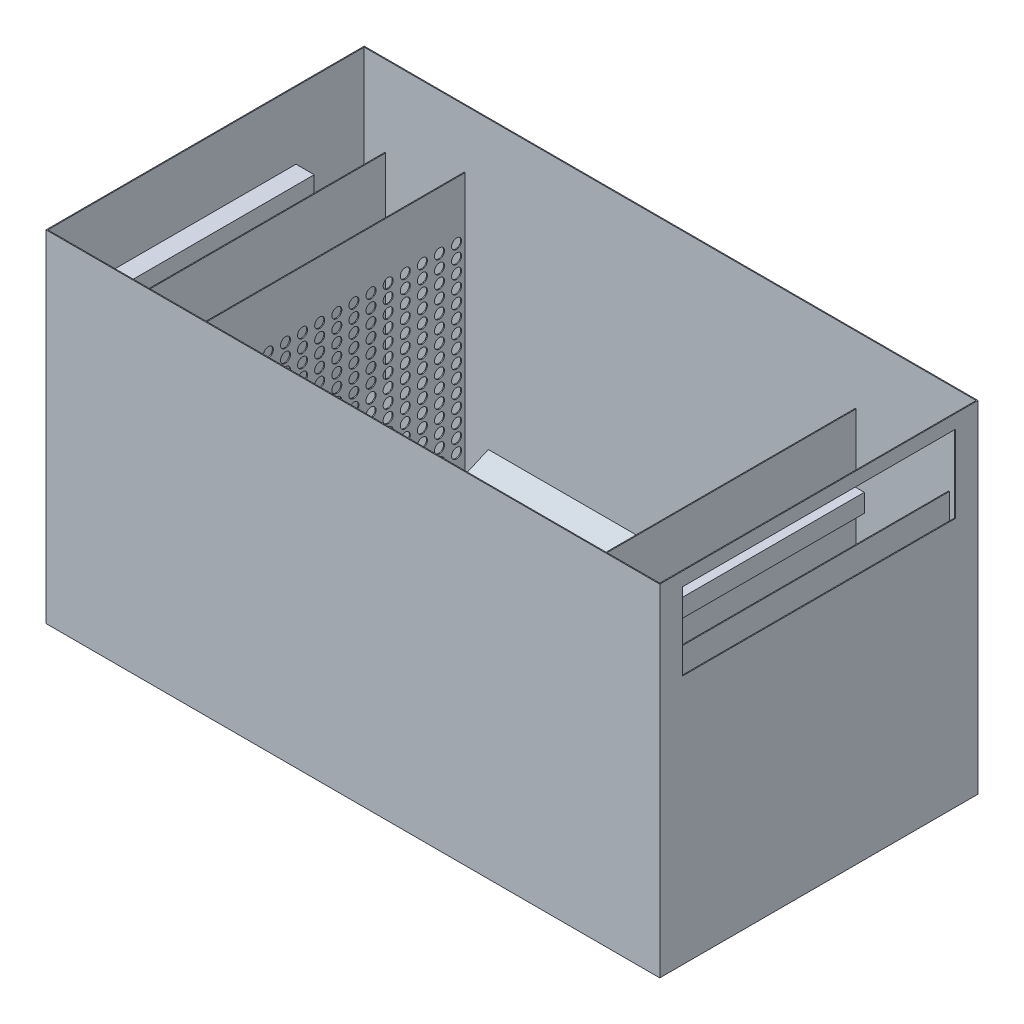
from build123d import *

# Parameters (mm, degrees)
MASTER_FOOTPRINT_W            = 1350
MASTER_FOOTPRINT_H            = 700
BATH_BASE_PLATE_DEPTH         = 750
BATH_SHELL_2MM_T              = -2
SKETCH_1_R                    = 50
INLET_D100_OPENING_DEPTH      = 10
INLET_IMPACT_BAFFLE_START     = 125
SKETCH_2_W                    = 540
SKETCH_2_H                    = 430
INLET_IMPACT_BAFFLE_DEPTH     = 2
DISTRIBUTOR_D22_START         = 250
SKETCH_3_W                    = 640
SKETCH_3_H                    = 648
SKETCH_3_R                    = 11
DISTRIBUTOR_D22_DEPTH         = 2
OUTLET_SUBMERGED_BAFFLE_START = 1130
SKETCH_4_W                    = 600
SKETCH_4_H                    = 330
OUTLET_SUBMERGED_BAFFLE_DEPTH = 2
OVERFLOW_WEIR_Z550_START      = 1290
SKETCH_5_W                    = 690
SKETCH_5_H                    = 548
OVERFLOW_WEIR_Z550_DEPTH      = 2
OUTLET_WEIR_SLOT_W600_START   = 1345
SKETCH_6_W                    = 600
SKETCH_6_H                    = 170
OUTLET_WEIR_SLOT_W600_DEPTH   = 10
SLOPED_SEDIMENT_FLOOR_START   = 275
SLOPED_SEDIMENT_FLOOR_DEPTH   = 825
SKETCH_8_W                    = 40
SKETCH_8_H                    = 40
FRAME_FOUR_LEGS_40X40_DEPTH   = 500
FRAME_FOUR_LEGS_40X40_2_DEPTH = 500
FRAME_FOUR_LEGS_40X40_3_DEPTH = 500
FRAME_FOUR_LEGS_40X40_4_DEPTH = 500


with BuildPart() as part:
    # MASTER_FOOTPRINT → BATH_BASE_PLATE (new body)
    with BuildSketch(Plane(origin=(0, 0, 0), x_dir=(1, 0, 0), z_dir=(0, 1, 0))):
        with Locations((675, 350)):
            Rectangle(MASTER_FOOTPRINT_W, MASTER_FOOTPRINT_H)
    extrude(amount=BATH_BASE_PLATE_DEPTH)

    # BATH_SHELL_2MM
    bath_shell_2mm_openings = [part.faces().sort_by_distance(p)[0] for p in [
        (675, 750, -350),
    ]]
    offset(amount=BATH_SHELL_2MM_T, openings=bath_shell_2mm_openings, kind=Kind.INTERSECTION)

    # Эскиз1 → INLET_D100_OPENING (cut)
    with BuildSketch(Plane(origin=(0, 0, 0), x_dir=(0, 0, -1), z_dir=(1, 0, 0))):
        with Locations((350, 420)):
            Circle(SKETCH_1_R)
    extrude(amount=INLET_D100_OPENING_DEPTH, mode=Mode.SUBTRACT)

    # Эскиз6 → OUTLET_WEIR_SLOT_W600 (cut)
    with BuildSketch(Plane(origin=(0, 0, 0), x_dir=(0, 0, -1), z_dir=(1, 0, 0)).offset(OUTLET_WEIR_SLOT_W600_START)):
        with Locations((350, 635)):
            Rectangle(SKETCH_6_W, SKETCH_6_H)
    extrude(amount=OUTLET_WEIR_SLOT_W600_DEPTH, mode=Mode.SUBTRACT)

    # Эскиз7 → SLOPED_SEDIMENT_FLOOR (add)
    with BuildSketch(Plane(origin=(0, 0, 0), x_dir=(0, 0, -1), z_dir=(1, 0, 0)).offset(SLOPED_SEDIMENT_FLOOR_START)):
        Polygon((2, -1), (2, 120), (280, -1), align=None)
        Polygon((698, -1), (698, 120), (420, -1), align=None)
    extrude(amount=SLOPED_SEDIMENT_FLOOR_DEPTH)


with BuildPart() as body_2:
    # Эскиз2 → INLET_IMPACT_BAFFLE (new body)
    with BuildSketch(Plane(origin=(0, 0, 0), x_dir=(0, 0, -1), z_dir=(1, 0, 0)).offset(INLET_IMPACT_BAFFLE_START)):
        with Locations((350, 435)):
            Rectangle(SKETCH_2_W, SKETCH_2_H)
    extrude(amount=INLET_IMPACT_BAFFLE_DEPTH)


with BuildPart() as body_3:
    # Эскиз3 → DISTRIBUTOR_D22 (new body)
    with BuildSketch(Plane(origin=(0, 0, 0), x_dir=(0, 0, -1), z_dir=(1, 0, 0)).offset(DISTRIBUTOR_D22_START)):
        with Locations((350, 326)):
            Rectangle(SKETCH_3_W, SKETCH_3_H)
        with Locations((48.823529412, 125)):
            Circle(SKETCH_3_R, mode=Mode.SUBTRACT)
        with Locations((48.823529412, 153.5)):
            Circle(SKETCH_3_R, mode=Mode.SUBTRACT)
        with Locations((48.823529412, 182)):
            Circle(SKETCH_3_R, mode=Mode.SUBTRACT)
        with Locations((48.823529412, 210.5)):
            Circle(SKETCH_3_R, mode=Mode.SUBTRACT)
        with Locations((48.823529412, 239)):
            Circle(SKETCH_3_R, mode=Mode.SUBTRACT)
        with Locations((48.823529412, 267.5)):
            Circle(SKETCH_3_R, mode=Mode.SUBTRACT)
        with Locations((48.823529412, 296)):
            Circle(SKETCH_3_R, mode=Mode.SUBTRACT)
        with Locations((48.823529412, 324.5)):
            Circle(SKETCH_3_R, mode=Mode.SUBTRACT)
        with Locations((48.823529412, 353)):
            Circle(SKETCH_3_R, mode=Mode.SUBTRACT)
        with Locations((48.823529412, 381.5)):
            Circle(SKETCH_3_R, mode=Mode.SUBTRACT)
        with Locations((48.823529412, 410)):
            Circle(SKETCH_3_R, mode=Mode.SUBTRACT)
        with Locations((48.823529412, 438.5)):
            Circle(SKETCH_3_R, mode=Mode.SUBTRACT)
        with Locations((48.823529412, 467)):
            Circle(SKETCH_3_R, mode=Mode.SUBTRACT)
        with Locations((48.823529412, 495.5)):
            Circle(SKETCH_3_R, mode=Mode.SUBTRACT)
        with Locations((48.823529412, 524)):
            Circle(SKETCH_3_R, mode=Mode.SUBTRACT)
        with Locations((86.470588235, 125)):
            Circle(SKETCH_3_R, mode=Mode.SUBTRACT)
        with Locations((86.470588235, 153.5)):
            Circle(SKETCH_3_R, mode=Mode.SUBTRACT)
        with Locations((86.470588235, 182)):
            Circle(SKETCH_3_R, mode=Mode.SUBTRACT)
        with Locations((86.470588235, 210.5)):
            Circle(SKETCH_3_R, mode=Mode.SUBTRACT)
        with Locations((86.470588235, 239)):
            Circle(SKETCH_3_R, mode=Mode.SUBTRACT)
        with Locations((86.470588235, 267.5)):
            Circle(SKETCH_3_R, mode=Mode.SUBTRACT)
        with Locations((86.470588235, 296)):
            Circle(SKETCH_3_R, mode=Mode.SUBTRACT)
        with Locations((86.470588235, 324.5)):
            Circle(SKETCH_3_R, mode=Mode.SUBTRACT)
        with Locations((86.470588235, 353)):
            Circle(SKETCH_3_R, mode=Mode.SUBTRACT)
        with Locations((86.470588235, 381.5)):
            Circle(SKETCH_3_R, mode=Mode.SUBTRACT)
        with Locations((86.470588235, 410)):
            Circle(SKETCH_3_R, mode=Mode.SUBTRACT)
        with Locations((86.470588235, 438.5)):
            Circle(SKETCH_3_R, mode=Mode.SUBTRACT)
        with Locations((86.470588235, 467)):
            Circle(SKETCH_3_R, mode=Mode.SUBTRACT)
        with Locations((86.470588235, 495.5)):
            Circle(SKETCH_3_R, mode=Mode.SUBTRACT)
        with Locations((86.470588235, 524)):
            Circle(SKETCH_3_R, mode=Mode.SUBTRACT)
        with Locations((124.117647059, 125)):
            Circle(SKETCH_3_R, mode=Mode.SUBTRACT)
        with Locations((124.117647059, 153.5)):
            Circle(SKETCH_3_R, mode=Mode.SUBTRACT)
        with Locations((124.117647059, 182)):
            Circle(SKETCH_3_R, mode=Mode.SUBTRACT)
        with Locations((124.117647059, 210.5)):
            Circle(SKETCH_3_R, mode=Mode.SUBTRACT)
        with Locations((124.117647059, 239)):
            Circle(SKETCH_3_R, mode=Mode.SUBTRACT)
        with Locations((124.117647059, 267.5)):
            Circle(SKETCH_3_R, mode=Mode.SUBTRACT)
        with Locations((124.117647059, 296)):
            Circle(SKETCH_3_R, mode=Mode.SUBTRACT)
        with Locations((124.117647059, 324.5)):
            Circle(SKETCH_3_R, mode=Mode.SUBTRACT)
        with Locations((124.117647059, 353)):
            Circle(SKETCH_3_R, mode=Mode.SUBTRACT)
        with Locations((124.117647059, 381.5)):
            Circle(SKETCH_3_R, mode=Mode.SUBTRACT)
        with Locations((124.117647059, 410)):
            Circle(SKETCH_3_R, mode=Mode.SUBTRACT)
        with Locations((124.117647059, 438.5)):
            Circle(SKETCH_3_R, mode=Mode.SUBTRACT)
        with Locations((124.117647059, 467)):
            Circle(SKETCH_3_R, mode=Mode.SUBTRACT)
        with Locations((124.117647059, 495.5)):
            Circle(SKETCH_3_R, mode=Mode.SUBTRACT)
        with Locations((124.117647059, 524)):
            Circle(SKETCH_3_R, mode=Mode.SUBTRACT)
        with Locations((161.764705882, 125)):
            Circle(SKETCH_3_R, mode=Mode.SUBTRACT)
        with Locations((161.764705882, 153.5)):
            Circle(SKETCH_3_R, mode=Mode.SUBTRACT)
        with Locations((161.764705882, 182)):
            Circle(SKETCH_3_R, mode=Mode.SUBTRACT)
        with Locations((161.764705882, 210.5)):
            Circle(SKETCH_3_R, mode=Mode.SUBTRACT)
        with Locations((161.764705882, 239)):
            Circle(SKETCH_3_R, mode=Mode.SUBTRACT)
        with Locations((161.764705882, 267.5)):
            Circle(SKETCH_3_R, mode=Mode.SUBTRACT)
        with Locations((161.764705882, 296)):
            Circle(SKETCH_3_R, mode=Mode.SUBTRACT)
        with Locations((161.764705882, 324.5)):
            Circle(SKETCH_3_R, mode=Mode.SUBTRACT)
        with Locations((161.764705882, 353)):
            Circle(SKETCH_3_R, mode=Mode.SUBTRACT)
        with Locations((161.764705882, 381.5)):
            Circle(SKETCH_3_R, mode=Mode.SUBTRACT)
        with Locations((161.764705882, 410)):
            Circle(SKETCH_3_R, mode=Mode.SUBTRACT)
        with Locations((161.764705882, 438.5)):
            Circle(SKETCH_3_R, mode=Mode.SUBTRACT)
        with Locations((161.764705882, 467)):
            Circle(SKETCH_3_R, mode=Mode.SUBTRACT)
        with Locations((161.764705882, 495.5)):
            Circle(SKETCH_3_R, mode=Mode.SUBTRACT)
        with Locations((161.764705882, 524)):
            Circle(SKETCH_3_R, mode=Mode.SUBTRACT)
        with Locations((199.411764706, 125)):
            Circle(SKETCH_3_R, mode=Mode.SUBTRACT)
        with Locations((199.411764706, 153.5)):
            Circle(SKETCH_3_R, mode=Mode.SUBTRACT)
        with Locations((199.411764706, 182)):
            Circle(SKETCH_3_R, mode=Mode.SUBTRACT)
        with Locations((199.411764706, 210.5)):
            Circle(SKETCH_3_R, mode=Mode.SUBTRACT)
        with Locations((199.411764706, 239)):
            Circle(SKETCH_3_R, mode=Mode.SUBTRACT)
        with Locations((199.411764706, 267.5)):
            Circle(SKETCH_3_R, mode=Mode.SUBTRACT)
        with Locations((199.411764706, 296)):
            Circle(SKETCH_3_R, mode=Mode.SUBTRACT)
        with Locations((199.411764706, 324.5)):
            Circle(SKETCH_3_R, mode=Mode.SUBTRACT)
        with Locations((199.411764706, 353)):
            Circle(SKETCH_3_R, mode=Mode.SUBTRACT)
        with Locations((199.411764706, 381.5)):
            Circle(SKETCH_3_R, mode=Mode.SUBTRACT)
        with Locations((199.411764706, 410)):
            Circle(SKETCH_3_R, mode=Mode.SUBTRACT)
        with Locations((199.411764706, 438.5)):
            Circle(SKETCH_3_R, mode=Mode.SUBTRACT)
        with Locations((199.411764706, 467)):
            Circle(SKETCH_3_R, mode=Mode.SUBTRACT)
        with Locations((199.411764706, 495.5)):
            Circle(SKETCH_3_R, mode=Mode.SUBTRACT)
        with Locations((199.411764706, 524)):
            Circle(SKETCH_3_R, mode=Mode.SUBTRACT)
        with Locations((237.058823529, 125)):
            Circle(SKETCH_3_R, mode=Mode.SUBTRACT)
        with Locations((237.058823529, 153.5)):
            Circle(SKETCH_3_R, mode=Mode.SUBTRACT)
        with Locations((237.058823529, 182)):
            Circle(SKETCH_3_R, mode=Mode.SUBTRACT)
        with Locations((237.058823529, 210.5)):
            Circle(SKETCH_3_R, mode=Mode.SUBTRACT)
        with Locations((237.058823529, 239)):
            Circle(SKETCH_3_R, mode=Mode.SUBTRACT)
        with Locations((237.058823529, 267.5)):
            Circle(SKETCH_3_R, mode=Mode.SUBTRACT)
        with Locations((237.058823529, 296)):
            Circle(SKETCH_3_R, mode=Mode.SUBTRACT)
        with Locations((237.058823529, 324.5)):
            Circle(SKETCH_3_R, mode=Mode.SUBTRACT)
        with Locations((237.058823529, 353)):
            Circle(SKETCH_3_R, mode=Mode.SUBTRACT)
        with Locations((237.058823529, 381.5)):
            Circle(SKETCH_3_R, mode=Mode.SUBTRACT)
        with Locations((237.058823529, 410)):
            Circle(SKETCH_3_R, mode=Mode.SUBTRACT)
        with Locations((237.058823529, 438.5)):
            Circle(SKETCH_3_R, mode=Mode.SUBTRACT)
        with Locations((237.058823529, 467)):
            Circle(SKETCH_3_R, mode=Mode.SUBTRACT)
        with Locations((237.058823529, 495.5)):
            Circle(SKETCH_3_R, mode=Mode.SUBTRACT)
        with Locations((237.058823529, 524)):
            Circle(SKETCH_3_R, mode=Mode.SUBTRACT)
        with Locations((274.705882353, 125)):
            Circle(SKETCH_3_R, mode=Mode.SUBTRACT)
        with Locations((274.705882353, 153.5)):
            Circle(SKETCH_3_R, mode=Mode.SUBTRACT)
        with Locations((274.705882353, 182)):
            Circle(SKETCH_3_R, mode=Mode.SUBTRACT)
        with Locations((274.705882353, 210.5)):
            Circle(SKETCH_3_R, mode=Mode.SUBTRACT)
        with Locations((274.705882353, 239)):
            Circle(SKETCH_3_R, mode=Mode.SUBTRACT)
        with Locations((274.705882353, 267.5)):
            Circle(SKETCH_3_R, mode=Mode.SUBTRACT)
        with Locations((274.705882353, 296)):
            Circle(SKETCH_3_R, mode=Mode.SUBTRACT)
        with Locations((274.705882353, 324.5)):
            Circle(SKETCH_3_R, mode=Mode.SUBTRACT)
        with Locations((274.705882353, 353)):
            Circle(SKETCH_3_R, mode=Mode.SUBTRACT)
        with Locations((274.705882353, 381.5)):
            Circle(SKETCH_3_R, mode=Mode.SUBTRACT)
        with Locations((274.705882353, 410)):
            Circle(SKETCH_3_R, mode=Mode.SUBTRACT)
        with Locations((274.705882353, 438.5)):
            Circle(SKETCH_3_R, mode=Mode.SUBTRACT)
        with Locations((274.705882353, 467)):
            Circle(SKETCH_3_R, mode=Mode.SUBTRACT)
        with Locations((274.705882353, 495.5)):
            Circle(SKETCH_3_R, mode=Mode.SUBTRACT)
        with Locations((274.705882353, 524)):
            Circle(SKETCH_3_R, mode=Mode.SUBTRACT)
        with Locations((312.352941176, 125)):
            Circle(SKETCH_3_R, mode=Mode.SUBTRACT)
        with Locations((312.352941176, 153.5)):
            Circle(SKETCH_3_R, mode=Mode.SUBTRACT)
        with Locations((312.352941176, 182)):
            Circle(SKETCH_3_R, mode=Mode.SUBTRACT)
        with Locations((312.352941176, 210.5)):
            Circle(SKETCH_3_R, mode=Mode.SUBTRACT)
        with Locations((312.352941176, 239)):
            Circle(SKETCH_3_R, mode=Mode.SUBTRACT)
        with Locations((312.352941176, 267.5)):
            Circle(SKETCH_3_R, mode=Mode.SUBTRACT)
        with Locations((312.352941176, 296)):
            Circle(SKETCH_3_R, mode=Mode.SUBTRACT)
        with Locations((312.352941176, 324.5)):
            Circle(SKETCH_3_R, mode=Mode.SUBTRACT)
        with Locations((312.352941176, 353)):
            Circle(SKETCH_3_R, mode=Mode.SUBTRACT)
        with Locations((312.352941176, 381.5)):
            Circle(SKETCH_3_R, mode=Mode.SUBTRACT)
        with Locations((312.352941176, 410)):
            Circle(SKETCH_3_R, mode=Mode.SUBTRACT)
        with Locations((312.352941176, 438.5)):
            Circle(SKETCH_3_R, mode=Mode.SUBTRACT)
        with Locations((312.352941176, 467)):
            Circle(SKETCH_3_R, mode=Mode.SUBTRACT)
        with Locations((312.352941176, 495.5)):
            Circle(SKETCH_3_R, mode=Mode.SUBTRACT)
        with Locations((312.352941176, 524)):
            Circle(SKETCH_3_R, mode=Mode.SUBTRACT)
        with Locations((350, 125)):
            Circle(SKETCH_3_R, mode=Mode.SUBTRACT)
        with Locations((350, 153.5)):
            Circle(SKETCH_3_R, mode=Mode.SUBTRACT)
        with Locations((350, 182)):
            Circle(SKETCH_3_R, mode=Mode.SUBTRACT)
        with Locations((350, 210.5)):
            Circle(SKETCH_3_R, mode=Mode.SUBTRACT)
        with Locations((350, 239)):
            Circle(SKETCH_3_R, mode=Mode.SUBTRACT)
        with Locations((350, 267.5)):
            Circle(SKETCH_3_R, mode=Mode.SUBTRACT)
        with Locations((350, 296)):
            Circle(SKETCH_3_R, mode=Mode.SUBTRACT)
        with Locations((350, 324.5)):
            Circle(SKETCH_3_R, mode=Mode.SUBTRACT)
        with Locations((350, 353)):
            Circle(SKETCH_3_R, mode=Mode.SUBTRACT)
        with Locations((350, 381.5)):
            Circle(SKETCH_3_R, mode=Mode.SUBTRACT)
        with Locations((350, 410)):
            Circle(SKETCH_3_R, mode=Mode.SUBTRACT)
        with Locations((350, 438.5)):
            Circle(SKETCH_3_R, mode=Mode.SUBTRACT)
        with Locations((350, 467)):
            Circle(SKETCH_3_R, mode=Mode.SUBTRACT)
        with Locations((350, 495.5)):
            Circle(SKETCH_3_R, mode=Mode.SUBTRACT)
        with Locations((350, 524)):
            Circle(SKETCH_3_R, mode=Mode.SUBTRACT)
        with Locations((387.647058824, 125)):
            Circle(SKETCH_3_R, mode=Mode.SUBTRACT)
        with Locations((387.647058824, 153.5)):
            Circle(SKETCH_3_R, mode=Mode.SUBTRACT)
        with Locations((387.647058824, 182)):
            Circle(SKETCH_3_R, mode=Mode.SUBTRACT)
        with Locations((387.647058824, 210.5)):
            Circle(SKETCH_3_R, mode=Mode.SUBTRACT)
        with Locations((387.647058824, 239)):
            Circle(SKETCH_3_R, mode=Mode.SUBTRACT)
        with Locations((387.647058824, 267.5)):
            Circle(SKETCH_3_R, mode=Mode.SUBTRACT)
        with Locations((387.647058824, 296)):
            Circle(SKETCH_3_R, mode=Mode.SUBTRACT)
        with Locations((387.647058824, 324.5)):
            Circle(SKETCH_3_R, mode=Mode.SUBTRACT)
        with Locations((387.647058824, 353)):
            Circle(SKETCH_3_R, mode=Mode.SUBTRACT)
        with Locations((387.647058824, 381.5)):
            Circle(SKETCH_3_R, mode=Mode.SUBTRACT)
        with Locations((387.647058824, 410)):
            Circle(SKETCH_3_R, mode=Mode.SUBTRACT)
        with Locations((387.647058824, 438.5)):
            Circle(SKETCH_3_R, mode=Mode.SUBTRACT)
        with Locations((387.647058824, 467)):
            Circle(SKETCH_3_R, mode=Mode.SUBTRACT)
        with Locations((387.647058824, 495.5)):
            Circle(SKETCH_3_R, mode=Mode.SUBTRACT)
        with Locations((387.647058824, 524)):
            Circle(SKETCH_3_R, mode=Mode.SUBTRACT)
        with Locations((425.294117647, 125)):
            Circle(SKETCH_3_R, mode=Mode.SUBTRACT)
        with Locations((425.294117647, 153.5)):
            Circle(SKETCH_3_R, mode=Mode.SUBTRACT)
        with Locations((425.294117647, 182)):
            Circle(SKETCH_3_R, mode=Mode.SUBTRACT)
        with Locations((425.294117647, 210.5)):
            Circle(SKETCH_3_R, mode=Mode.SUBTRACT)
        with Locations((425.294117647, 239)):
            Circle(SKETCH_3_R, mode=Mode.SUBTRACT)
        with Locations((425.294117647, 267.5)):
            Circle(SKETCH_3_R, mode=Mode.SUBTRACT)
        with Locations((425.294117647, 296)):
            Circle(SKETCH_3_R, mode=Mode.SUBTRACT)
        with Locations((425.294117647, 324.5)):
            Circle(SKETCH_3_R, mode=Mode.SUBTRACT)
        with Locations((425.294117647, 353)):
            Circle(SKETCH_3_R, mode=Mode.SUBTRACT)
        with Locations((425.294117647, 381.5)):
            Circle(SKETCH_3_R, mode=Mode.SUBTRACT)
        with Locations((425.294117647, 410)):
            Circle(SKETCH_3_R, mode=Mode.SUBTRACT)
        with Locations((425.294117647, 438.5)):
            Circle(SKETCH_3_R, mode=Mode.SUBTRACT)
        with Locations((425.294117647, 467)):
            Circle(SKETCH_3_R, mode=Mode.SUBTRACT)
        with Locations((425.294117647, 495.5)):
            Circle(SKETCH_3_R, mode=Mode.SUBTRACT)
        with Locations((425.294117647, 524)):
            Circle(SKETCH_3_R, mode=Mode.SUBTRACT)
        with Locations((462.941176471, 125)):
            Circle(SKETCH_3_R, mode=Mode.SUBTRACT)
        with Locations((462.941176471, 153.5)):
            Circle(SKETCH_3_R, mode=Mode.SUBTRACT)
        with Locations((462.941176471, 182)):
            Circle(SKETCH_3_R, mode=Mode.SUBTRACT)
        with Locations((462.941176471, 210.5)):
            Circle(SKETCH_3_R, mode=Mode.SUBTRACT)
        with Locations((462.941176471, 239)):
            Circle(SKETCH_3_R, mode=Mode.SUBTRACT)
        with Locations((462.941176471, 267.5)):
            Circle(SKETCH_3_R, mode=Mode.SUBTRACT)
        with Locations((462.941176471, 296)):
            Circle(SKETCH_3_R, mode=Mode.SUBTRACT)
        with Locations((462.941176471, 324.5)):
            Circle(SKETCH_3_R, mode=Mode.SUBTRACT)
        with Locations((462.941176471, 353)):
            Circle(SKETCH_3_R, mode=Mode.SUBTRACT)
        with Locations((462.941176471, 381.5)):
            Circle(SKETCH_3_R, mode=Mode.SUBTRACT)
        with Locations((462.941176471, 410)):
            Circle(SKETCH_3_R, mode=Mode.SUBTRACT)
        with Locations((462.941176471, 438.5)):
            Circle(SKETCH_3_R, mode=Mode.SUBTRACT)
        with Locations((462.941176471, 467)):
            Circle(SKETCH_3_R, mode=Mode.SUBTRACT)
        with Locations((462.941176471, 495.5)):
            Circle(SKETCH_3_R, mode=Mode.SUBTRACT)
        with Locations((462.941176471, 524)):
            Circle(SKETCH_3_R, mode=Mode.SUBTRACT)
        with Locations((500.588235294, 125)):
            Circle(SKETCH_3_R, mode=Mode.SUBTRACT)
        with Locations((500.588235294, 153.5)):
            Circle(SKETCH_3_R, mode=Mode.SUBTRACT)
        with Locations((500.588235294, 182)):
            Circle(SKETCH_3_R, mode=Mode.SUBTRACT)
        with Locations((500.588235294, 210.5)):
            Circle(SKETCH_3_R, mode=Mode.SUBTRACT)
        with Locations((500.588235294, 239)):
            Circle(SKETCH_3_R, mode=Mode.SUBTRACT)
        with Locations((500.588235294, 267.5)):
            Circle(SKETCH_3_R, mode=Mode.SUBTRACT)
        with Locations((500.588235294, 296)):
            Circle(SKETCH_3_R, mode=Mode.SUBTRACT)
        with Locations((500.588235294, 324.5)):
            Circle(SKETCH_3_R, mode=Mode.SUBTRACT)
        with Locations((500.588235294, 353)):
            Circle(SKETCH_3_R, mode=Mode.SUBTRACT)
        with Locations((500.588235294, 381.5)):
            Circle(SKETCH_3_R, mode=Mode.SUBTRACT)
        with Locations((500.588235294, 410)):
            Circle(SKETCH_3_R, mode=Mode.SUBTRACT)
        with Locations((500.588235294, 438.5)):
            Circle(SKETCH_3_R, mode=Mode.SUBTRACT)
        with Locations((500.588235294, 467)):
            Circle(SKETCH_3_R, mode=Mode.SUBTRACT)
        with Locations((500.588235294, 495.5)):
            Circle(SKETCH_3_R, mode=Mode.SUBTRACT)
        with Locations((500.588235294, 524)):
            Circle(SKETCH_3_R, mode=Mode.SUBTRACT)
        with Locations((538.235294118, 125)):
            Circle(SKETCH_3_R, mode=Mode.SUBTRACT)
        with Locations((538.235294118, 153.5)):
            Circle(SKETCH_3_R, mode=Mode.SUBTRACT)
        with Locations((538.235294118, 182)):
            Circle(SKETCH_3_R, mode=Mode.SUBTRACT)
        with Locations((538.235294118, 210.5)):
            Circle(SKETCH_3_R, mode=Mode.SUBTRACT)
        with Locations((538.235294118, 239)):
            Circle(SKETCH_3_R, mode=Mode.SUBTRACT)
        with Locations((538.235294118, 267.5)):
            Circle(SKETCH_3_R, mode=Mode.SUBTRACT)
        with Locations((538.235294118, 296)):
            Circle(SKETCH_3_R, mode=Mode.SUBTRACT)
        with Locations((538.235294118, 324.5)):
            Circle(SKETCH_3_R, mode=Mode.SUBTRACT)
        with Locations((538.235294118, 353)):
            Circle(SKETCH_3_R, mode=Mode.SUBTRACT)
        with Locations((538.235294118, 381.5)):
            Circle(SKETCH_3_R, mode=Mode.SUBTRACT)
        with Locations((538.235294118, 410)):
            Circle(SKETCH_3_R, mode=Mode.SUBTRACT)
        with Locations((538.235294118, 438.5)):
            Circle(SKETCH_3_R, mode=Mode.SUBTRACT)
        with Locations((538.235294118, 467)):
            Circle(SKETCH_3_R, mode=Mode.SUBTRACT)
        with Locations((538.235294118, 495.5)):
            Circle(SKETCH_3_R, mode=Mode.SUBTRACT)
        with Locations((538.235294118, 524)):
            Circle(SKETCH_3_R, mode=Mode.SUBTRACT)
        with Locations((575.882352941, 125)):
            Circle(SKETCH_3_R, mode=Mode.SUBTRACT)
        with Locations((575.882352941, 153.5)):
            Circle(SKETCH_3_R, mode=Mode.SUBTRACT)
        with Locations((575.882352941, 182)):
            Circle(SKETCH_3_R, mode=Mode.SUBTRACT)
        with Locations((575.882352941, 210.5)):
            Circle(SKETCH_3_R, mode=Mode.SUBTRACT)
        with Locations((575.882352941, 239)):
            Circle(SKETCH_3_R, mode=Mode.SUBTRACT)
        with Locations((575.882352941, 267.5)):
            Circle(SKETCH_3_R, mode=Mode.SUBTRACT)
        with Locations((575.882352941, 296)):
            Circle(SKETCH_3_R, mode=Mode.SUBTRACT)
        with Locations((575.882352941, 324.5)):
            Circle(SKETCH_3_R, mode=Mode.SUBTRACT)
        with Locations((575.882352941, 353)):
            Circle(SKETCH_3_R, mode=Mode.SUBTRACT)
        with Locations((575.882352941, 381.5)):
            Circle(SKETCH_3_R, mode=Mode.SUBTRACT)
        with Locations((575.882352941, 410)):
            Circle(SKETCH_3_R, mode=Mode.SUBTRACT)
        with Locations((575.882352941, 438.5)):
            Circle(SKETCH_3_R, mode=Mode.SUBTRACT)
        with Locations((575.882352941, 467)):
            Circle(SKETCH_3_R, mode=Mode.SUBTRACT)
        with Locations((575.882352941, 495.5)):
            Circle(SKETCH_3_R, mode=Mode.SUBTRACT)
        with Locations((575.882352941, 524)):
            Circle(SKETCH_3_R, mode=Mode.SUBTRACT)
        with Locations((613.529411765, 125)):
            Circle(SKETCH_3_R, mode=Mode.SUBTRACT)
        with Locations((613.529411765, 153.5)):
            Circle(SKETCH_3_R, mode=Mode.SUBTRACT)
        with Locations((613.529411765, 182)):
            Circle(SKETCH_3_R, mode=Mode.SUBTRACT)
        with Locations((613.529411765, 210.5)):
            Circle(SKETCH_3_R, mode=Mode.SUBTRACT)
        with Locations((613.529411765, 239)):
            Circle(SKETCH_3_R, mode=Mode.SUBTRACT)
        with Locations((613.529411765, 267.5)):
            Circle(SKETCH_3_R, mode=Mode.SUBTRACT)
        with Locations((613.529411765, 296)):
            Circle(SKETCH_3_R, mode=Mode.SUBTRACT)
        with Locations((613.529411765, 324.5)):
            Circle(SKETCH_3_R, mode=Mode.SUBTRACT)
        with Locations((613.529411765, 353)):
            Circle(SKETCH_3_R, mode=Mode.SUBTRACT)
        with Locations((613.529411765, 381.5)):
            Circle(SKETCH_3_R, mode=Mode.SUBTRACT)
        with Locations((613.529411765, 410)):
            Circle(SKETCH_3_R, mode=Mode.SUBTRACT)
        with Locations((613.529411765, 438.5)):
            Circle(SKETCH_3_R, mode=Mode.SUBTRACT)
        with Locations((613.529411765, 467)):
            Circle(SKETCH_3_R, mode=Mode.SUBTRACT)
        with Locations((613.529411765, 495.5)):
            Circle(SKETCH_3_R, mode=Mode.SUBTRACT)
        with Locations((613.529411765, 524)):
            Circle(SKETCH_3_R, mode=Mode.SUBTRACT)
        with Locations((651.176470588, 125)):
            Circle(SKETCH_3_R, mode=Mode.SUBTRACT)
        with Locations((651.176470588, 153.5)):
            Circle(SKETCH_3_R, mode=Mode.SUBTRACT)
        with Locations((651.176470588, 182)):
            Circle(SKETCH_3_R, mode=Mode.SUBTRACT)
        with Locations((651.176470588, 210.5)):
            Circle(SKETCH_3_R, mode=Mode.SUBTRACT)
        with Locations((651.176470588, 239)):
            Circle(SKETCH_3_R, mode=Mode.SUBTRACT)
        with Locations((651.176470588, 267.5)):
            Circle(SKETCH_3_R, mode=Mode.SUBTRACT)
        with Locations((651.176470588, 296)):
            Circle(SKETCH_3_R, mode=Mode.SUBTRACT)
        with Locations((651.176470588, 324.5)):
            Circle(SKETCH_3_R, mode=Mode.SUBTRACT)
        with Locations((651.176470588, 353)):
            Circle(SKETCH_3_R, mode=Mode.SUBTRACT)
        with Locations((651.176470588, 381.5)):
            Circle(SKETCH_3_R, mode=Mode.SUBTRACT)
        with Locations((651.176470588, 410)):
            Circle(SKETCH_3_R, mode=Mode.SUBTRACT)
        with Locations((651.176470588, 438.5)):
            Circle(SKETCH_3_R, mode=Mode.SUBTRACT)
        with Locations((651.176470588, 467)):
            Circle(SKETCH_3_R, mode=Mode.SUBTRACT)
        with Locations((651.176470588, 495.5)):
            Circle(SKETCH_3_R, mode=Mode.SUBTRACT)
        with Locations((651.176470588, 524)):
            Circle(SKETCH_3_R, mode=Mode.SUBTRACT)
    extrude(amount=DISTRIBUTOR_D22_DEPTH)


with BuildPart() as body_4:
    # Эскиз4 → OUTLET_SUBMERGED_BAFFLE (new body)
    with BuildSketch(Plane(origin=(0, 0, 0), x_dir=(0, 0, -1), z_dir=(1, 0, 0)).offset(OUTLET_SUBMERGED_BAFFLE_START)):
        with Locations((350, 485)):
            Rectangle(SKETCH_4_W, SKETCH_4_H)
    extrude(amount=OUTLET_SUBMERGED_BAFFLE_DEPTH)


with BuildPart() as body_5:
    # Эскиз5 → OVERFLOW_WEIR_Z550 (new body)
    with BuildSketch(Plane(origin=(0, 0, 0), x_dir=(0, 0, -1), z_dir=(1, 0, 0)).offset(OVERFLOW_WEIR_Z550_START)):
        with Locations((350, 276)):
            Rectangle(SKETCH_5_W, SKETCH_5_H)
    extrude(amount=OVERFLOW_WEIR_Z550_DEPTH)


with BuildPart() as body_6:
    # Эскиз8 → FRAME_FOUR_LEGS_40X40 (new body)
    with BuildSketch(Plane.XY):
        with Locations((70, 70)):
            Rectangle(SKETCH_8_W, SKETCH_8_H)
    extrude(amount=-FRAME_FOUR_LEGS_40X40_DEPTH)


with BuildPart() as body_7:
    # Эскиз8 → FRAME_FOUR_LEGS_40X40 2 (new body)
    with BuildSketch(Plane.XY):
        with Locations((70, 630)):
            Rectangle(SKETCH_8_W, SKETCH_8_H)
    extrude(amount=-FRAME_FOUR_LEGS_40X40_2_DEPTH)


with BuildPart() as body_8:
    # Эскиз8 → FRAME_FOUR_LEGS_40X40 3 (new body)
    with BuildSketch(Plane.XY):
        with Locations((1280, 70)):
            Rectangle(SKETCH_8_W, SKETCH_8_H)
    extrude(amount=-FRAME_FOUR_LEGS_40X40_3_DEPTH)


with BuildPart() as body_9:
    # Эскиз8 → FRAME_FOUR_LEGS_40X40 4 (new body)
    with BuildSketch(Plane.XY):
        with Locations((1280, 630)):
            Rectangle(SKETCH_8_W, SKETCH_8_H)
    extrude(amount=-FRAME_FOUR_LEGS_40X40_4_DEPTH)


solid = Compound([part.part, body_2.part, body_3.part, body_4.part, body_5.part, body_6.part, body_7.part, body_8.part, body_9.part])
